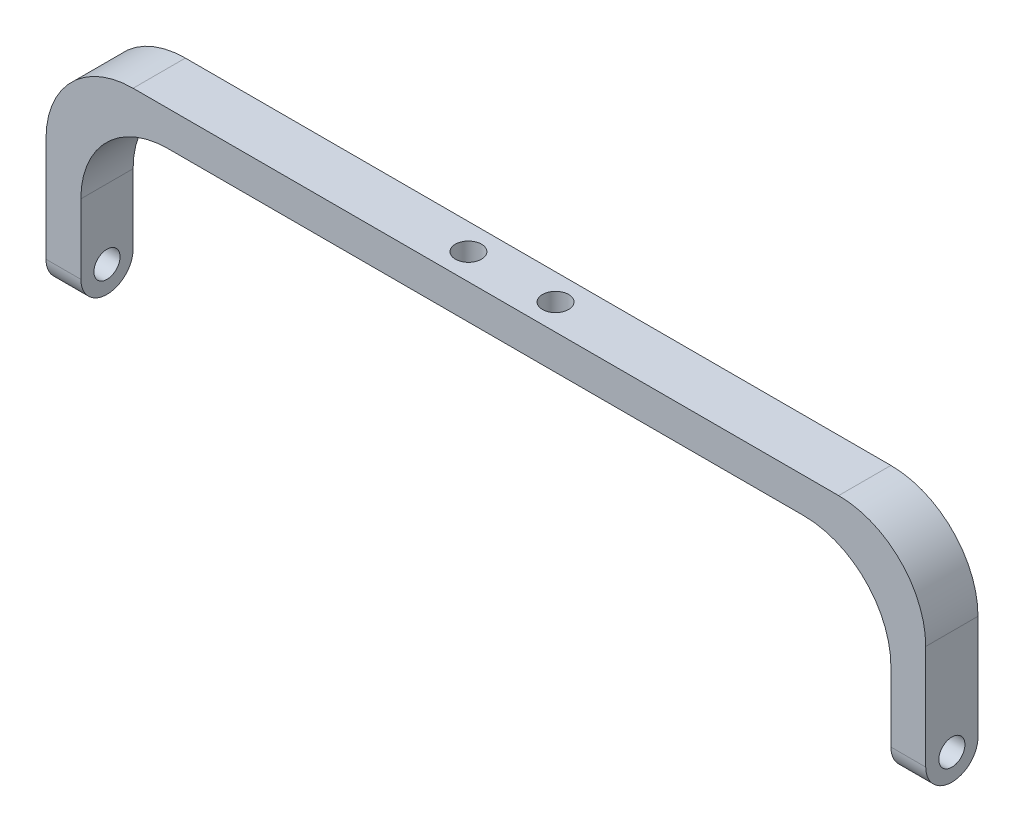
from build123d import *

# Parameters (mm, degrees)
BOSS_EXTRUDE1_DEPTH = 6
SKETCH2_R           = 1.5
CUT_EXTRUDE1_DEPTH  = 104
FILLET1_R           = 10
FILLET2_R           = 3
SKETCH3_R           = 1.5
CUT_EXTRUDE2_DEPTH  = 4


with BuildPart() as part:
    # Sketch1 → Boss-Extrude1 (new body)
    with BuildSketch(Plane.XY):
        Polygon((-157.044043164, 91.385212048), (-157.044043164, 116.385212048), (-56.044043164, 116.385212048), (-56.044043164, 91.385212048), (-60.044043164, 91.385212048), (-60.044043164, 112.385212048), (-153.044043164, 112.385212048), (-153.044043164, 91.385212048), align=None)
    extrude(amount=BOSS_EXTRUDE1_DEPTH)

    # Sketch2 → Cut-Extrude1 (cut)
    with BuildSketch(Plane(origin=(-56.044043164, 0, 0), x_dir=(0, 0, -1), z_dir=(1, 0, 0))):
        with Locations((-3, 94.381633834)):
            Circle(SKETCH2_R)
    extrude(amount=-CUT_EXTRUDE1_DEPTH, mode=Mode.SUBTRACT)

    # Fillet1
    fillet1_edges = [part.edges().sort_by_distance(p)[0] for p in [
        (-157.044043164, 116.385212048, 3),
        (-56.044043164, 116.385212048, 3),
        (-60.044043164, 112.385212048, 3),
        (-153.044043164, 112.385212048, 3),
    ]]
    fillet(fillet1_edges, radius=FILLET1_R)

    # Fillet2
    fillet2_edges = [part.edges().sort_by_distance(p)[0] for p in [
        (-58.044043164, 91.385212048, 6),
        (-58.044043164, 91.385212048, 0),
        (-155.044043164, 91.385212048, 0),
        (-155.044043164, 91.385212048, 6),
    ]]
    fillet(fillet2_edges, radius=FILLET2_R - 0.0001)  # a hair under: the kernel refuses the full size

    # Sketch3 → Cut-Extrude2 (cut)
    with BuildSketch(Plane(origin=(0, 116.385212048, 0), x_dir=(1, 0, 0), z_dir=(0, 1, 0))):
        with Locations(Location((-101.544043164, -3, 0), (0, 0, 270))):
            Circle(SKETCH3_R)
        with Locations(Location((-111.544043164, -3, 0), (0, 0, 90))):
            Circle(SKETCH3_R)
    extrude(amount=-CUT_EXTRUDE2_DEPTH, mode=Mode.SUBTRACT)


solid = part.part
